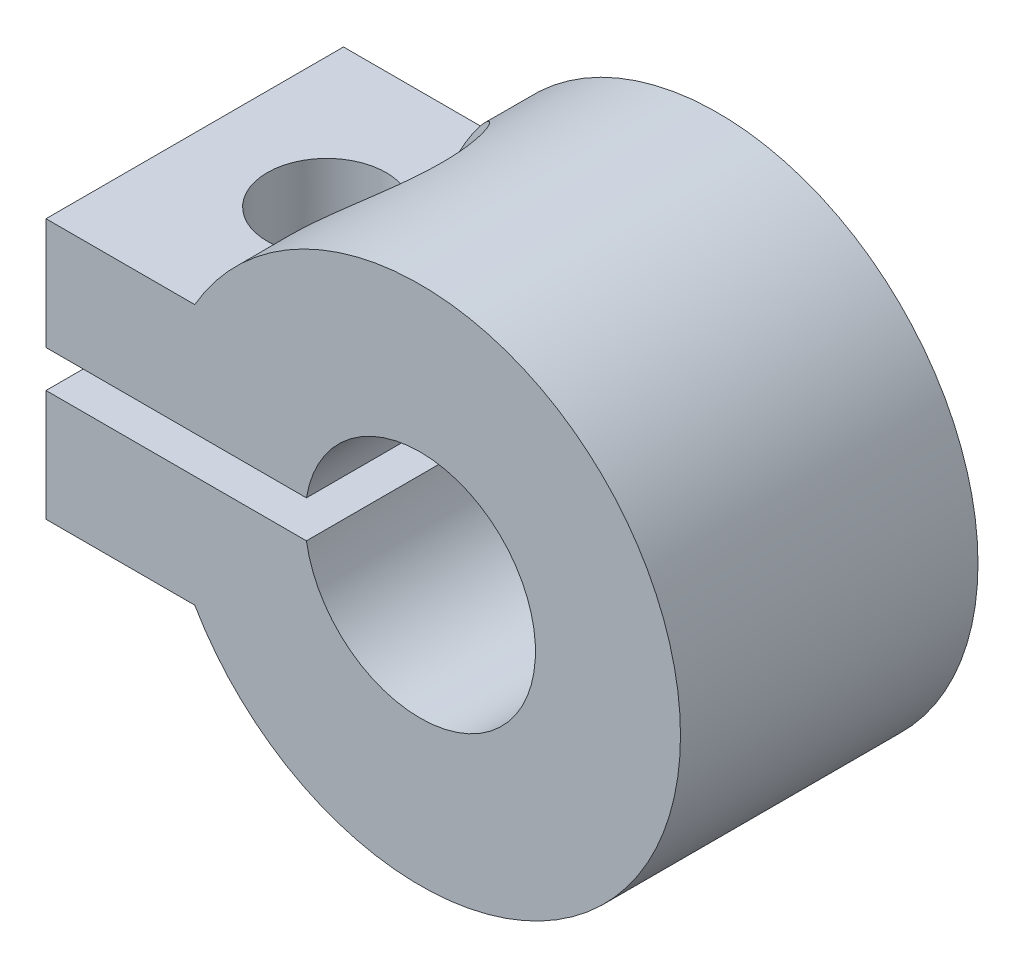
from build123d import *

# Parameters (mm, degrees)
BOSS_EXTRUDE1_DEPTH = 8
SKETCH2_R           = 1.6
CUT_EXTRUDE1_DEPTH  = 17.598115032
SKETCH3_R           = 3.1
CUT_EXTRUDE2_DEPTH  = 17.598115143
SKETCH4_R           = 3.1
CUT_EXTRUDE3_DEPTH  = 17.598115143


with BuildPart() as part:
    # Sketch1 → Boss-Extrude1 (new body)
    with BuildSketch(Plane.XY):
        with BuildLine():
            Line((-6.062177826, 3.5), (-10.062177826, 3.5))
            Line((-10.062177826, 3.5), (-10.062177826, 0.5))
            Line((-10.062177826, 0.5), (-3.059411708, 0.5))
            ThreePointArc((-3.059411708, 0.5), (3.1, 0), (-3.059411708, -0.5))
            Line((-3.059411708, -0.5), (-10.062177826, -0.5))
            Line((-10.062177826, -0.5), (-10.062177826, -3.5))
            Line((-10.062177826, -3.5), (-6.062177826, -3.5))
            ThreePointArc((-6.062177826, -3.5), (7, 0), (-6.062177826, 3.5))
        make_face()
    extrude(amount=BOSS_EXTRUDE1_DEPTH)

    # Sketch2 → Cut-Extrude1 (cut, through all)
    with BuildSketch(Plane(origin=(0, 3.5, 0), x_dir=(1, 0, 0), z_dir=(0, 1, 0))):
        with Locations((-6.562177826, -3.951427487)):
            Circle(SKETCH2_R)
    extrude(amount=-CUT_EXTRUDE1_DEPTH, mode=Mode.SUBTRACT)

    # Sketch3 → Cut-Extrude2 (cut, through all)
    with BuildSketch(Plane(origin=(0, 3.5, 0), x_dir=(1, 0, 0), z_dir=(0, 1, 0))):
        with Locations((-6.562177826, -3.951427487)):
            Circle(SKETCH3_R)
    extrude(amount=CUT_EXTRUDE2_DEPTH, mode=Mode.SUBTRACT)

    # Sketch4 → Cut-Extrude3 (cut, through all)
    with BuildSketch(Plane.XZ.offset(3.5)):
        with Locations((-6.562177826, 3.951427487)):
            Circle(SKETCH4_R)
    extrude(amount=CUT_EXTRUDE3_DEPTH, mode=Mode.SUBTRACT)


solid = part.part
